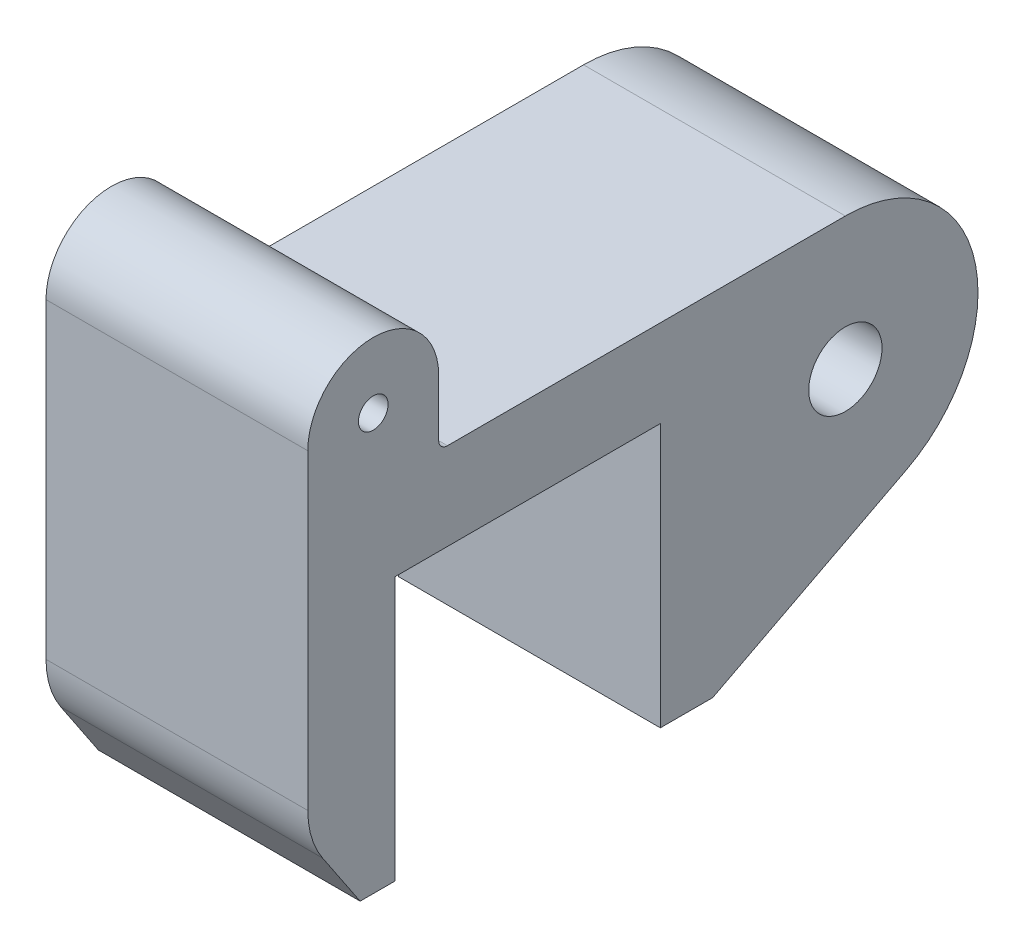
from build123d import *

# Parameters (mm, degrees)
SKETCH1_R           = 1.7
SKETCH1_R_2         = 4.2
BOSS_EXTRUDE1_DEPTH = 15


with BuildPart() as part:
    # Sketch1 → Boss-Extrude1 (new, symmetric)
    with BuildSketch(Plane.YZ):
        with BuildLine():
            Line((0, 0), (-30.2, 0))
            Line((-30.2, 0), (-30.2, -6))
            Line((-30.2, -6), (-18.69469651, -28.195224522))
            ThreePointArc((-18.69469651, -28.195224522), (-1.599957427, -35.967521575), (10, -21.2))
            Line((10, -21.2), (10, 24.4))
            ThreePointArc((10, 24.4), (10.292893219, 25.107106781), (11, 25.4))
            Line((11, 25.4), (17.5, 25.4))
            ThreePointArc((17.5, 25.4), (25, 32.9), (17.5, 40.4))
            Line((17.5, 40.4), (-18.2, 40.4))
            ThreePointArc((-18.2, 40.4), (-21.107339833, 39.96803925), (-23.763508327, 38.709475019))
            Line((-23.763508327, 38.709475019), (-30.2, 34.4))
            Line((-30.2, 34.4), (-30.2, 30.4))
            Line((-30.2, 30.4), (0, 30.4))
            Line((0, 30.4), (0, 0))
        make_face()
        with Locations((17.5, 32.9)):
            Circle(SKETCH1_R, mode=Mode.SUBTRACT)
        with Locations((-5.2, -21.2)):
            Circle(SKETCH1_R_2, mode=Mode.SUBTRACT)
    extrude(amount=BOSS_EXTRUDE1_DEPTH, both=True)


solid = part.part
